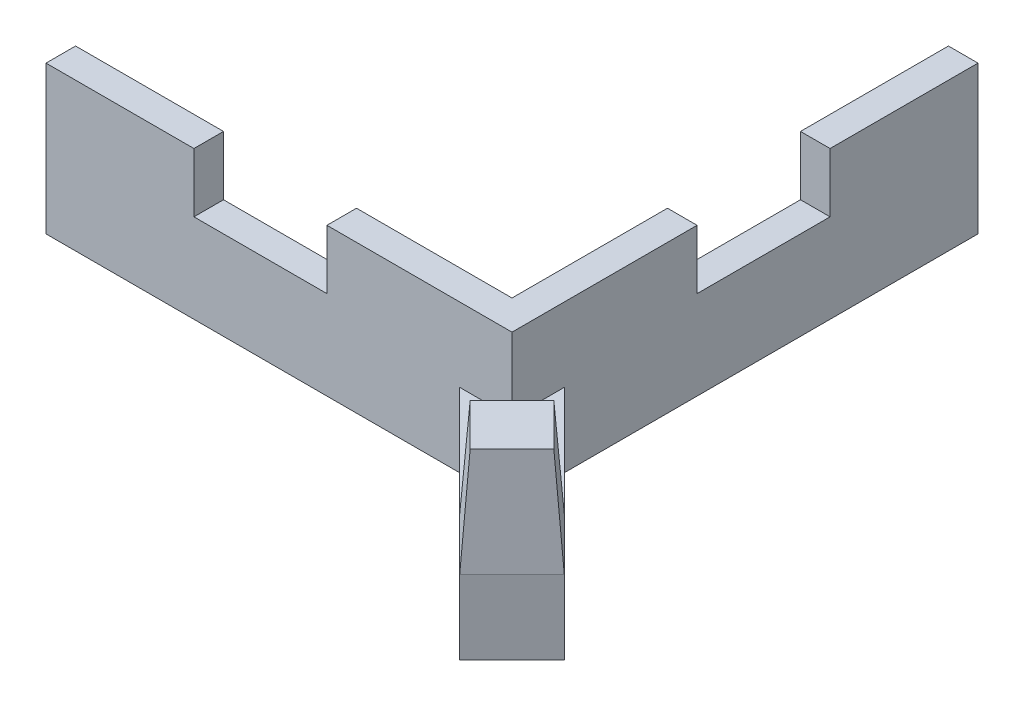
from build123d import *

# Parameters (mm, degrees)
SKETCH2_W           = 10.5
SKETCH2_H           = 10
BOSS_EXTRUDE1_DEPTH = 2
SKETCH3_W           = 2
SKETCH3_H           = 10
BOSS_EXTRUDE2_DEPTH = 2
SKETCH4_W           = 2
SKETCH4_H           = 10
BOSS_EXTRUDE3_DEPTH = 10.5
SKETCH18_W          = 2
SKETCH18_H          = 10
BOSS_EXTRUDE6_DEPTH = 19
SKETCH19_W          = 8.99
SKETCH19_H          = 5
CUT_EXTRUDE1_DEPTH  = 19
SKETCH20_W          = 2
SKETCH20_H          = 10
BOSS_EXTRUDE7_DEPTH = 19
SKETCH21_W          = 8.99
SKETCH21_H          = 5
CUT_EXTRUDE2_DEPTH  = 19
BOSS_EXTRUDE8_REACH = 54.114
SKETCH22_W          = 5
SKETCH22_H          = 5
SKETCH23_W          = 5
SKETCH23_H          = 5
BOSS_EXTRUDE9_DEPTH = 10
LOFT1_DEPTH         = 7
LOFT1_DRAFT         = 4.0856168


# Read off the part's stored shape, not the designer's step: Loft1
with BuildPart() as part:
    # Sketch2 → Boss-Extrude1 (new body)
    with BuildSketch(Plane.XY):
        with Locations((5.25, -15)):
            Rectangle(SKETCH2_W, SKETCH2_H)
    extrude(amount=BOSS_EXTRUDE1_DEPTH)

    # Sketch3 → Boss-Extrude2 (add)
    with BuildSketch(Plane(origin=(10.5, 0, 0), x_dir=(0, 0, -1), z_dir=(1, 0, 0))):
        with Locations((-1, -15)):
            Rectangle(SKETCH3_W, SKETCH3_H)
    extrude(amount=BOSS_EXTRUDE2_DEPTH)

    # Sketch4 → Boss-Extrude3 (add)
    with BuildSketch(Plane(origin=(0, 0, 0), x_dir=(-1, 0, 0), z_dir=(0, 0, -1))):
        with Locations((-11.5, -15)):
            Rectangle(SKETCH4_W, SKETCH4_H)
    extrude(amount=BOSS_EXTRUDE3_DEPTH)

    # Sketch18 → Boss-Extrude6 (add)
    with BuildSketch(Plane(origin=(0, 0, -10.5), x_dir=(-1, 0, 0), z_dir=(0, 0, -1))):
        with Locations((-11.5, -15)):
            Rectangle(SKETCH18_W, SKETCH18_H)
    extrude(amount=BOSS_EXTRUDE6_DEPTH)

    # Sketch19 → Cut-Extrude1 (cut)
    with BuildSketch(Plane(origin=(12.5, 0, 0), x_dir=(0, 0, -1), z_dir=(1, 0, 0))):
        with Locations((15.005, -11.5)):
            Rectangle(SKETCH19_W, SKETCH19_H)
    extrude(amount=-CUT_EXTRUDE1_DEPTH, mode=Mode.SUBTRACT)

    # Sketch20 → Boss-Extrude7 (add)
    with BuildSketch(Plane.ZY):
        with Locations((1, -15)):
            Rectangle(SKETCH20_W, SKETCH20_H)
    extrude(amount=BOSS_EXTRUDE7_DEPTH)

    # Sketch21 → Cut-Extrude2 (cut)
    with BuildSketch(Plane.XY.offset(2)):
        with Locations((-4.505, -11.5)):
            Rectangle(SKETCH21_W, SKETCH21_H)
    extrude(amount=-CUT_EXTRUDE2_DEPTH, mode=Mode.SUBTRACT)

    # Sketch22 → Boss-Extrude8 (add, up to next)
    with BuildSketch(Plane(origin=(9.371320344, 0, 9.371320344), x_dir=(0.7071067811865476, 0, -0.7071067811865476), z_dir=(0.7071067811865476, 0, 0.7071067811865476)), mode=Mode.PRIVATE) as boss_extrude8_sk1:
        with Locations((7.424621202, -17.5)):
            Rectangle(SKETCH22_W, SKETCH22_H)
    boss_extrude8_tool1 = extrude(boss_extrude8_sk1.sketch, amount=-BOSS_EXTRUDE8_REACH, mode=Mode.PRIVATE) - part.part
    add(boss_extrude8_tool1.solids().sort_by_distance((14.62132, -17.5, 4.12132))[0])

    # Sketch23 → Boss-Extrude9 (add)
    with BuildSketch(Plane(origin=(9.371320344, 0, 9.371320344), x_dir=(0.7071067811865475, 0, -0.7071067811865476), z_dir=(0.7071067811865476, 0, 0.7071067811865475))):
        with Locations((7.424621202, -17.5)):
            Rectangle(SKETCH23_W, SKETCH23_H)
    extrude(amount=BOSS_EXTRUDE9_DEPTH)


with BuildPart() as loft1_tool:
    # Loft1 outline → Loft1 (with draft: the straight prism first)
    with BuildSketch(Plane(origin=(0, -8, 0), x_dir=(1, 0, 0), z_dir=(0, 1, 0))):
        Polygon((17.096194078, -9.424621202), (19.924621202, -12.253048327), (22.753048327, -9.424621202), (19.924621202, -6.596194078), align=None)
    extrude(amount=-LOFT1_DEPTH)
    # Loft1: the draft: its side faces are tilted about the plane it starts from
    loft1_sides = [loft1_tool.faces().sort_by_distance(p)[0] for p in [
        (18.51040764, -11.5, 10.838834765),
        (21.338834764, -11.5, 10.838834764),
        (21.338834764, -11.5, 8.01040764),
        (18.51040764, -11.5, 8.01040764),
    ]]
    draft(loft1_sides, Plane(origin=(0, -8, 0), x_dir=(1, 0, 0), z_dir=(0, 1, 0)), LOFT1_DRAFT)


with BuildPart() as part_1:
    add(part.part)

    # Loft1: add loft1_tool
    add(loft1_tool.part)


solid = part_1.part
